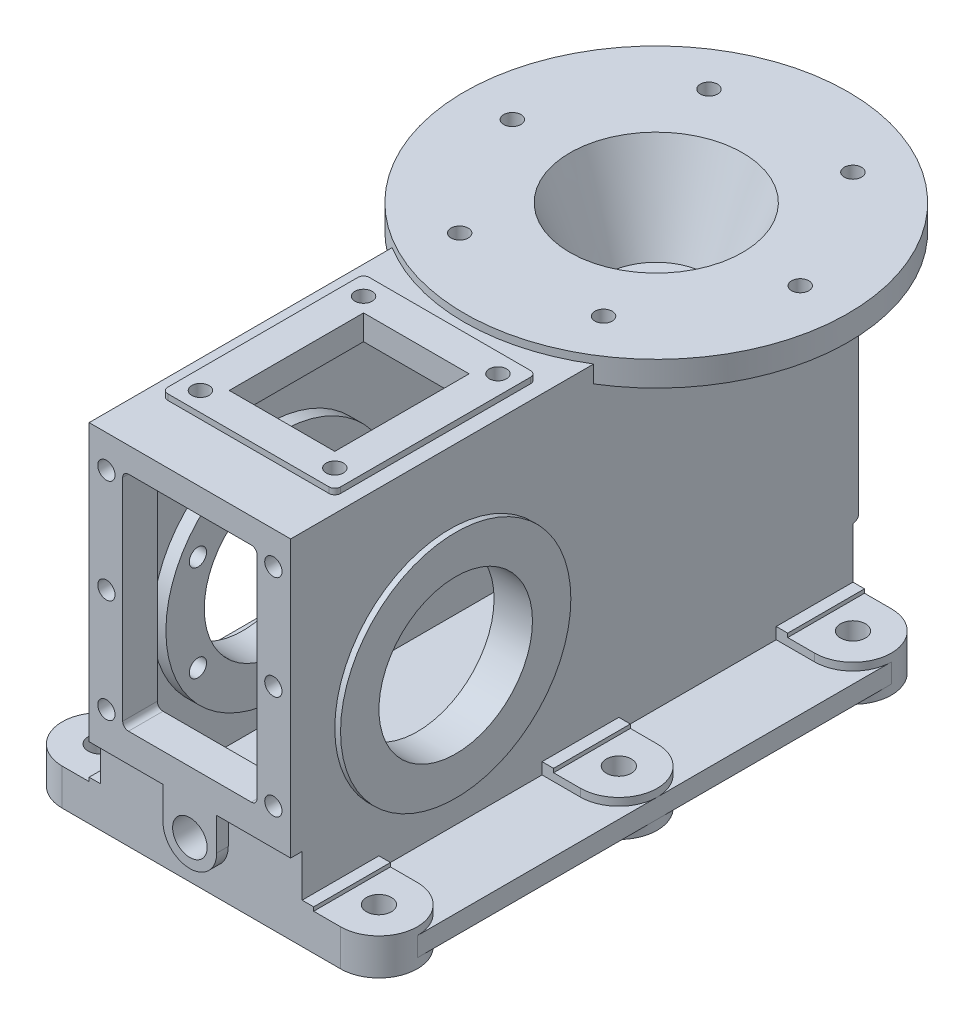
from build123d import *
from build123d.topology import SkipClean

# Parameters (mm, degrees)
EXTRUDE_1_DEPTH             = 287
FILLET_1_R                  = 20
EXTRUDE_2_DEPTH             = 6
EXTRUDE_2_DEPTH_BACK        = 15
EXTRUDE_2_START             = 10
SKETCH_10_W                 = 47.798359508
SKETCH_10_H                 = 19.464860124
SKETCH_10_W_2               = 45.270455595
SKETCH_10_H_2               = 16.178585038
CUT_EXTRUDE_4_DEPTH         = 353.206260592
EXTRUDE_3_DEPTH             = 6
SKETCH_12_W                 = 105
SKETCH_12_H                 = 85
EXTRUDE_4_DEPTH             = 3
SKETCH_13_W                 = 90
SKETCH_13_H                 = 105
EXTRUDE_5_DEPTH             = 3
FILLET_2_R                  = 3
CUT_EXTRUDE_5_DEPTH         = 42.5
CUT_EXTRUDE_6_REACH         = 363.255
SKETCH_15_W                 = 55
SKETCH_15_H                 = 70
CUT_EXTRUDE_7_REACH         = 363.106
SKETCH_16_W                 = 70
SKETCH_16_H                 = 116
FILLET_3_R                  = 3
CUT_EXTRUDE_8_REACH         = 365.61
SKETCH_20_R                 = 32
EXTRUDE_START               = -17
SKETCH_21_R                 = 60
EXTRUDE_6_DEPTH             = 20
SKETCH_22_R                 = 40
CUT_EXTRUDE_9_DEPTH         = 381.296266087
CUT_EXTRUDE_10_DEPTH        = 57
SKETCH_24_R                 = 6.5
CUT_EXTRUDE_11_DEPTH        = 355.165215683
M10X1_0_1_REACH             = 335.737
M10X1_0_1_BORE_R            = 4.5
PATTERN_CIRCULAR_1_COUNT    = 6
M10X1_0_2_D                 = 9
M10X1_0_2_DEPTH             = 13
PATTERN_CIRCULAR_2_COUNT    = 6
PATTERN_LINEAR_2_COUNT      = 3
PATTERN_LINEAR_2_PITCH      = 54
PATTERN_LINEAR_2_COUNT_DIR2 = 2
PATTERN_LINEAR_2_PITCH_DIR2 = 87
M10X1_0_4_D                 = 9
M10X1_0_4_DEPTH             = 13
M10X1_0_5_D                 = 9
M10X1_0_5_DEPTH             = 13
M10X1_0_6_D                 = 9
M10X1_0_6_DEPTH             = 13
M10X1_0_7_D                 = 9
M10X1_0_7_DEPTH             = 13
FILLET_4_R                  = 3
M10X1_0_8_D                 = 9
M10X1_0_8_DEPTH             = 15
M10X1_0_8_TIP               = 2.703872786
M10X1_0_9_D                 = 9
M10X1_0_9_DEPTH             = 15
M10X1_0_9_TIP               = 2.703872786
M10X1_0_10_D                = 9
M10X1_0_10_DEPTH            = 15
M10X1_0_10_TIP              = 2.703872786
M10X1_0_11_D                = 9
M10X1_0_11_DEPTH            = 15
M10X1_0_11_TIP              = 2.703872786
RIB_1_REACH                 = 363.172
SKETCH_44_WALL_W            = 786.633054646
SKETCH_44_WALL_H            = 12
M20X2_0_1_D                 = 18
M20X2_0_1_DEPTH             = 18


with BuildPart() as part:
    # 草圖1 → 填料-伸長1 (new body)
    with BuildSketch(Plane.XY):
        Polygon((92.5, 0), (-92.5, 0), (-92.5, 10), (-52.5, 10), (-52.5, 182), (52.5, 182), (52.5, 10), (92.5, 10), align=None)
    extrude(amount=EXTRUDE_1_DEPTH)

    # 圓角1
    fillet_1_edges = [part.edges().sort_by_distance(p)[0] for p in [
        (-92.5, 5, 287),
        (92.5, 5, 287),
        (92.5, 5, 0),
        (-92.5, 5, 0),
    ]]
    fillet(fillet_1_edges, radius=FILLET_1_R)

    # 草圖3 → 填料-伸長2 (add, two sides: drawn at the far end of the back side and taken through both)
    with SkipClean():  # the faces are left unmerged after this step: merging them gives an invalid solid
        with BuildSketch(Plane(origin=(0, 0, 0), x_dir=(1, 0, 0), z_dir=(0, 1, 0)).offset(EXTRUDE_2_START - EXTRUDE_2_DEPTH_BACK)):
            with BuildLine():
                Line((-72.5, -247), (72.5, -247))
                ThreePointArc((72.5, -247), (92.5, -267), (72.5, -287))
                Line((72.5, -287), (-72.5, -287))
                ThreePointArc((-72.5, -287), (-92.5, -267), (-72.5, -247))
            make_face()
            with BuildLine():
                Line((-72.5, -122), (72.5, -122))
                ThreePointArc((72.5, -122), (92.5, -142), (72.5, -162))
                Line((72.5, -162), (-72.5, -162))
                ThreePointArc((-72.5, -162), (-92.5, -142), (-72.5, -122))
            make_face()
            with BuildLine():
                Line((-72.5, 0), (72.5, 0))
                ThreePointArc((72.5, 0), (92.5, -20), (72.5, -40))
                Line((72.5, -40), (-72.5, -40))
                ThreePointArc((-72.5, -40), (-92.5, -20), (-72.5, 0))
            make_face()
        extrude(amount=EXTRUDE_2_DEPTH + EXTRUDE_2_DEPTH_BACK)

    # 草圖10 → 除料-伸長4 (cut, through all)
    with BuildSketch(Plane.XY.offset(287)):
        with Locations((82.399179754, 23.732430062)):
            Rectangle(SKETCH_10_W, SKETCH_10_H)
        with Locations((-81.135227798, 22.089292519)):
            Rectangle(SKETCH_10_W_2, SKETCH_10_H_2)
    extrude(amount=-CUT_EXTRUDE_4_DEPTH, mode=Mode.SUBTRACT)

    # 草圖11 → 填料-伸長3 (add)
    with BuildSketch(Plane.XY.offset(287)):
        with BuildLine():
            Line((-52.5, 182), (-52.5, 38))
            Line((-52.5, 38), (-14, 38))
            Line((-14, 38), (-14, 21))
            ThreePointArc((-14, 21), (0, 7), (14, 21))
            Line((14, 21), (14, 38))
            Line((14, 38), (52.5, 38))
            Line((52.5, 38), (52.5, 182))
            Line((52.5, 182), (-52.5, 182))
        make_face()
    extrude(amount=EXTRUDE_3_DEPTH)

    # 草圖12 → 填料-伸長4 (add)
    with BuildSketch(Plane(origin=(0, 0, 0), x_dir=(-1, 0, 0), z_dir=(0, 0, -1))):
        with Locations((0, 85)):
            Rectangle(SKETCH_12_W, SKETCH_12_H)
    extrude(amount=EXTRUDE_4_DEPTH)

    # 草圖13 → 填料-伸長5 (add)
    with BuildSketch(Plane(origin=(0, 182, 0), x_dir=(1, 0, 0), z_dir=(0, 1, 0))):
        with Locations((0, -210)):
            Rectangle(SKETCH_13_W, SKETCH_13_H)
    extrude(amount=EXTRUDE_5_DEPTH)

    # 圓角2
    fillet_2_edges = [part.edges().sort_by_distance(p)[0] for p in [
        (-45, 183.5, 157.5),
        (-45, 183.5, 262.5),
        (45, 183.5, 262.5),
        (45, 183.5, 157.5),
    ]]
    fillet(fillet_2_edges, radius=FILLET_2_R)

    # 草圖14 → 除料-伸長5 (cut, symmetric)
    with BuildSketch(Plane(origin=(0, 0, 0), x_dir=(0, 0, -1), z_dir=(1, 0, 0))):
        Polygon((-84, 10), (-275, 10), (-275, 172), (-100.434256619, 172), (-84, 130), align=None)
    extrude(amount=CUT_EXTRUDE_5_DEPTH, both=True, mode=Mode.SUBTRACT)

    # 草圖15 → 除料-伸長6 (cut, up to next)
    with BuildSketch(Plane(origin=(0, 185, 0), x_dir=(1, 0, 0), z_dir=(0, 1, 0)), mode=Mode.PRIVATE) as cut_extrude_6_sk1:
        with Locations((0, -210)):
            Rectangle(SKETCH_15_W, SKETCH_15_H)
    cut_extrude_6_tool1 = extrude(cut_extrude_6_sk1.sketch, amount=-CUT_EXTRUDE_6_REACH, mode=Mode.PRIVATE) & part.part
    add(cut_extrude_6_tool1.solids().sort_by_distance((0, 185, 210))[0], mode=Mode.SUBTRACT)

    # 草圖16 → 除料-伸長7 (cut, up to next)
    with BuildSketch(Plane.XY.offset(293), mode=Mode.PRIVATE) as cut_extrude_7_sk1:
        with Locations((0, 111)):
            Rectangle(SKETCH_16_W, SKETCH_16_H)
    cut_extrude_7_tool1 = extrude(cut_extrude_7_sk1.sketch, amount=-CUT_EXTRUDE_7_REACH, mode=Mode.PRIVATE) & part.part
    add(cut_extrude_7_tool1.solids().sort_by_distance((0, 111, 293))[0], mode=Mode.SUBTRACT)

    # 圓角3
    fillet_3_edges = [part.edges().sort_by_distance(p)[0] for p in [
        (35, 169, 284),
        (35, 53, 284),
        (-35, 53, 284),
        (-35, 169, 284),
    ]]
    fillet(fillet_3_edges, radius=FILLET_3_R)

    # 草圖17 → 旋轉1 (revolve)
    with BuildSketch(Plane(origin=(0, 0, 0), x_dir=(0, 0, -1), z_dir=(1, 0, 0))):
        Polygon((-50, 147.796034822), (-27.561045201, 147.796034822), (-7.957961174, 173), (50, 173), (50, 186), (-50, 186), align=None)
    revolve(axis=Axis((0, 147.796034822, 50), (0, 1, 0)))

    # 草圖18 → 除料-旋轉1 (revolve, cut)
    with BuildSketch(Plane(origin=(0, 0, 0), x_dir=(0, 0, -1), z_dir=(1, 0, 0))):
        Polygon((-50, 91.548026161), (-66, 91.548026161), (-66, 140), (-77, 140), (-95, 186), (-50, 186), align=None)
    revolve(axis=Axis((0, 186, 50), (0, -1, 0)), mode=Mode.SUBTRACT)

    # 草圖20 → 除料-伸長8 (cut, up to next)
    with BuildSketch(Plane(origin=(0, 0, -3), x_dir=(-1, 0, 0), z_dir=(0, 0, -1)), mode=Mode.PRIVATE) as cut_extrude_8_sk1:
        with Locations((0, 85)):
            Circle(SKETCH_20_R)
    cut_extrude_8_tool1 = extrude(cut_extrude_8_sk1.sketch, amount=-CUT_EXTRUDE_8_REACH, mode=Mode.PRIVATE) & part.part
    add(cut_extrude_8_tool1.solids().sort_by_distance((0, 85, -3))[0], mode=Mode.SUBTRACT)

    # 草圖21 → 填料-伸長6 (add)
    with BuildSketch(Plane.ZY.offset(52.5).offset(EXTRUDE_START)):
        with Locations((210, 85)):
            Circle(SKETCH_21_R)
    extrude_6 = extrude(amount=EXTRUDE_6_DEPTH)

    # 鏡射1: 填料-伸長6 across plane
    add(extrude_6.mirror(Plane(origin=(0, 0, 0), x_dir=(0, 0, 1), z_dir=(1, 0, 0))))

    # 草圖22 → 除料-伸長9 (cut, through all)
    with BuildSketch(Plane.ZY.offset(55.5)):
        with Locations(Location((210, 85, 0), (0, 0, 180))):
            Circle(SKETCH_22_R)
    extrude(amount=-CUT_EXTRUDE_9_DEPTH, mode=Mode.SUBTRACT)

    # 草圖23 → 除料-伸長10 (cut)
    with BuildSketch(Plane(origin=(0, 0, 15), x_dir=(-1, 0, 0), z_dir=(0, 0, -1))):
        with BuildLine():
            Line((-37.5, 48.809531642), (-37.5, -5))
            Line((-37.5, -5), (37.5, -5))
            Line((37.5, -5), (37.5, 48.809531642))
            ThreePointArc((37.5, 48.809531642), (35.681101181, 51.567248088), (32.43, 50.980959743))
            ThreePointArc((32.43, 50.980959743), (0, 38), (-32.43, 50.980959743))
            ThreePointArc((-32.43, 50.980959743), (-35.681101181, 51.567248088), (-37.5, 48.809531642))
        make_face()
    extrude(amount=-CUT_EXTRUDE_10_DEPTH, mode=Mode.SUBTRACT)

    # 草圖24 → 除料-伸長11 (cut, through all)
    with BuildSketch(Plane(origin=(0, 14, 0), x_dir=(1, 0, 0), z_dir=(0, 1, 0))):
        with Locations(Location((-72.5, -267, 0), (0, 0, 270))):
            Circle(SKETCH_24_R)
        with Locations(Location((72.5, -267, 0), (0, 0, 90))):
            Circle(SKETCH_24_R)
        with Locations(Location((-72.5, -142, 0), (0, 0, 270))):
            Circle(SKETCH_24_R)
        with Locations(Location((72.5, -142, 0), (0, 0, 90))):
            Circle(SKETCH_24_R)
        with Locations(Location((-72.5, -20, 0), (0, 0, 270))):
            Circle(SKETCH_24_R)
        with Locations(Location((72.5, -20, 0), (0, 0, 270))):
            Circle(SKETCH_24_R)
    extrude(amount=-CUT_EXTRUDE_11_DEPTH, mode=Mode.SUBTRACT)

    # M10x1.0 螺紋孔1 bore (on position points) → M10x1.0 螺紋孔1 (cut, up to next)
    with BuildSketch(Plane(origin=(-55.5, 135, 210), x_dir=(0, 0, -1), z_dir=(-1, 0, 0)), mode=Mode.PRIVATE) as m10x1_0_1_sk1:
        Circle(M10X1_0_1_BORE_R)
    m10x1_0_1_tool1 = extrude(m10x1_0_1_sk1.sketch, amount=-M10X1_0_1_REACH, mode=Mode.PRIVATE) & part.part
    m10x1_0_1 = m10x1_0_1_tool1.solids().sort_by_distance((-55.5, 135, 210))[0]
    add(m10x1_0_1, mode=Mode.SUBTRACT)

    # 環狀複製排列1: M10x1.0 螺紋孔1 ×6 about axis
    pattern_circular_1_axis = Axis((0, 85, 210), (1, 0, 0))
    for i in range(1, PATTERN_CIRCULAR_1_COUNT):
        add(m10x1_0_1.rotate(pattern_circular_1_axis, i * 360 / PATTERN_CIRCULAR_1_COUNT), mode=Mode.SUBTRACT)

    # M10x1.0 螺紋孔2
    with Locations(Plane(origin=(75, 186, 50), x_dir=(0, 0, 1), z_dir=(0, 1, 0))):
        with Locations((0, 0)):
            m10x1_0_2 = Hole(M10X1_0_2_D / 2, depth=M10X1_0_2_DEPTH)

    # 環狀複製排列2: M10x1.0 螺紋孔2 ×6 about axis
    pattern_circular_2_axis = Axis((0, 0, 50), (0, 1, 0))
    for i in range(1, PATTERN_CIRCULAR_2_COUNT):
        add(m10x1_0_2.rotate(pattern_circular_2_axis, i * 360 / PATTERN_CIRCULAR_2_COUNT), mode=Mode.SUBTRACT)

    # 草圖31 → M10x1.0 螺紋孔3 (revolve, cut)
    with BuildSketch(Plane(origin=(43.5, 165, 293), x_dir=(0, -1, 0), z_dir=(1, 0, 0))):
        Polygon((0, 0), (0, 17.703872786), (4.5, 15), (4.5, 0), align=None)
    m10x1_0_3 = revolve(axis=Axis((43.5, 165, 299.35), (0, 0, -1)), mode=Mode.SUBTRACT)

    # 直線複製排列2: M10x1.0 _3 3 × 2
    with Locations(*[(-j * PATTERN_LINEAR_2_PITCH_DIR2, -i * PATTERN_LINEAR_2_PITCH, 0) for i in range(PATTERN_LINEAR_2_COUNT) for j in range(PATTERN_LINEAR_2_COUNT_DIR2) if (i, j) != (0, 0)]):
        add(m10x1_0_3, mode=Mode.SUBTRACT)

    # M10x1.0 螺紋孔4
    with Locations(Plane(origin=(35, 185, 252.5), x_dir=(0, 0, 1), z_dir=(0, 1, 0))):
        with Locations((0, 0)):
            Hole(M10X1_0_4_D / 2, depth=M10X1_0_4_DEPTH)

    # M10x1.0 螺紋孔5
    with Locations(Plane(origin=(-35, 185, 167.5), x_dir=(0, 0, 1), z_dir=(0, 1, 0))):
        with Locations((0, 0)):
            Hole(M10X1_0_5_D / 2, depth=M10X1_0_5_DEPTH)

    # M10x1.0 螺紋孔6
    with Locations(Plane(origin=(35, 185, 167.5), x_dir=(0, 0, 1), z_dir=(0, 1, 0))):
        with Locations((0, 0)):
            Hole(M10X1_0_6_D / 2, depth=M10X1_0_6_DEPTH)

    # M10x1.0 螺紋孔7
    with Locations(Plane(origin=(-35, 185, 252.5), x_dir=(0, 0, 1), z_dir=(0, 1, 0))):
        with Locations((0, 0)):
            Hole(M10X1_0_7_D / 2, depth=M10X1_0_7_DEPTH)

    # 圓角4
    fillet_4_edges = [part.edges().sort_by_distance(p)[0] for p in [
        (0, 42.5, -3),
        (0, 127.5, -3),
    ]]
    fillet(fillet_4_edges, radius=FILLET_4_R - 0.0001)  # a hair under: the kernel refuses the full size

    # M10x1.0 螺紋孔8
    with Locations(Plane(origin=(-42.5, 111, -3), x_dir=(-1, 0, 0), z_dir=(0, 0, -1))):
        with Locations((0, 0)):
            Hole(M10X1_0_8_D / 2, depth=M10X1_0_8_DEPTH)
            with Locations((0, 0, -(M10X1_0_8_DEPTH + M10X1_0_8_TIP / 2))):  # 118° drill point
                Cone(0, M10X1_0_8_D / 2, M10X1_0_8_TIP, mode=Mode.SUBTRACT)

    # M10x1.0 螺紋孔9
    with Locations(Plane(origin=(-42.5, 59, -3), x_dir=(-1, 0, 0), z_dir=(0, 0, -1))):
        with Locations((0, 0)):
            Hole(M10X1_0_9_D / 2, depth=M10X1_0_9_DEPTH)
            with Locations((0, 0, -(M10X1_0_9_DEPTH + M10X1_0_9_TIP / 2))):  # 118° drill point
                Cone(0, M10X1_0_9_D / 2, M10X1_0_9_TIP, mode=Mode.SUBTRACT)

    # M10x1.0 螺紋孔10
    with Locations(Plane(origin=(42.5, 59, -3), x_dir=(-1, 0, 0), z_dir=(0, 0, -1))):
        with Locations((0, 0)):
            Hole(M10X1_0_10_D / 2, depth=M10X1_0_10_DEPTH)
            with Locations((0, 0, -(M10X1_0_10_DEPTH + M10X1_0_10_TIP / 2))):  # 118° drill point
                Cone(0, M10X1_0_10_D / 2, M10X1_0_10_TIP, mode=Mode.SUBTRACT)

    # M10x1.0 螺紋孔11
    with Locations(Plane(origin=(42.5, 111, -3), x_dir=(-1, 0, 0), z_dir=(0, 0, -1))):
        with Locations((0, 0)):
            Hole(M10X1_0_11_D / 2, depth=M10X1_0_11_DEPTH)
            with Locations((0, 0, -(M10X1_0_11_DEPTH + M10X1_0_11_TIP / 2))):  # 118° drill point
                Cone(0, M10X1_0_11_D / 2, M10X1_0_11_TIP, mode=Mode.SUBTRACT)

    # 草圖44 wall → 肋材1 (add, up to next)
    with BuildSketch(Plane(origin=(0, 152, -23), x_dir=(0, -0.674269364021, 0.738485493928), z_dir=(0, -0.738485493928, -0.674269364021)), mode=Mode.PRIVATE) as rib_1_sk1:
        Rectangle(SKETCH_44_WALL_W, SKETCH_44_WALL_H)
    rib_1_tool1 = extrude(rib_1_sk1.sketch, amount=-RIB_1_REACH, mode=Mode.PRIVATE) - part.part
    add(rib_1_tool1.solids().sort_by_distance((0, 152, -23))[0])

    # M20x2.0 螺紋孔1
    with Locations(Plane(origin=(0, 21, 293), x_dir=(1, 0, 0), z_dir=(0, 0, 1))):
        with Locations((0, 0)):
            Hole(M20X2_0_1_D / 2, depth=M20X2_0_1_DEPTH)


solid = part.part
